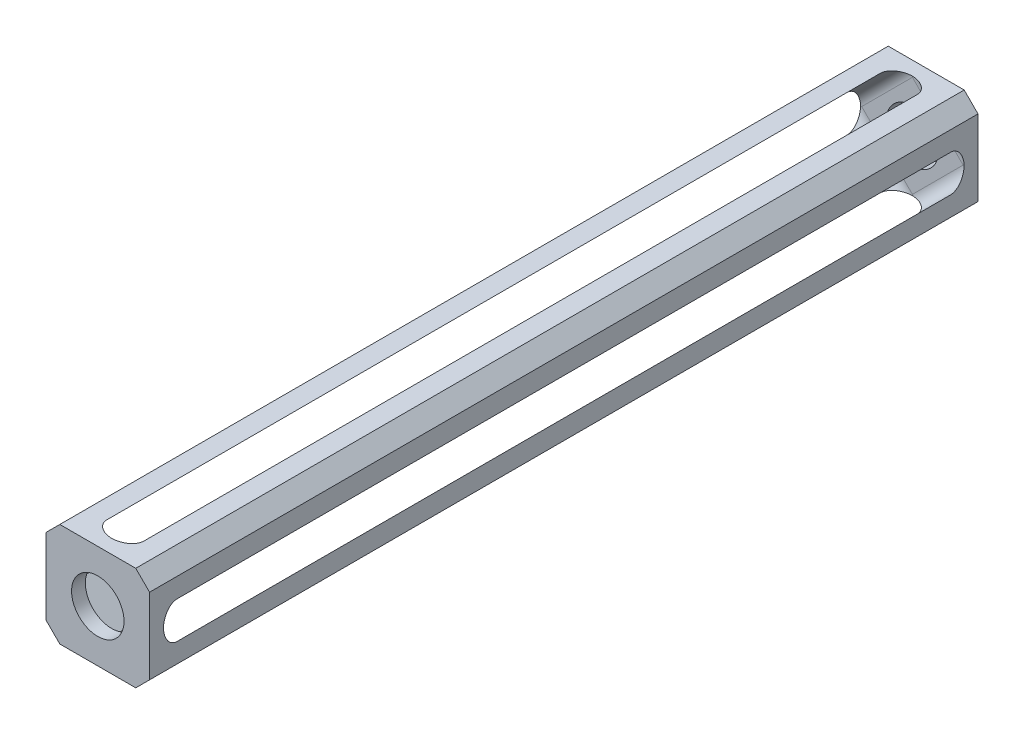
from build123d import *

# Parameters (mm, degrees)
SKETCH1_W           = 19.05
SKETCH1_H           = 19.05
BOSS_EXTRUDE1_DEPTH = 76.2
CHAMFER1_SIZE       = 2.54
SHELL1_T            = -2.54
FILLET1_R           = 2.54
SKETCH3_R           = 4.826
CUT_EXTRUDE1_DEPTH  = 153.9941543


with BuildPart() as part:
    # Sketch1 → Boss-Extrude1 (new, symmetric)
    with BuildSketch(Plane.XY):
        Rectangle(SKETCH1_W, SKETCH1_H)
    extrude(amount=BOSS_EXTRUDE1_DEPTH, both=True)

    # Chamfer1
    chamfer1_edges = [part.edges().sort_by_distance(p)[0] for p in [
        (9.525, -9.525, 0),
        (-9.525, -9.525, 0),
        (-9.525, 9.525, 0),
        (9.525, 9.525, 0),
    ]]
    chamfer(chamfer1_edges, length=CHAMFER1_SIZE)

    # Shell1
    shell1_openings = [part.faces().sort_by_distance(p)[0] for p in [
        (0, -9.525, 0),
        (-9.525, 0, 0),
        (0, 9.525, 0),
        (9.525, 0, 0),
    ]]
    offset(amount=SHELL1_T, openings=shell1_openings, kind=Kind.INTERSECTION)

    # Fillet1
    # the kernel refuses this fillet: 2.54 mm, written as the material it adds along each edge
    with BuildSketch(Plane(origin=(1.097230509, 14.015128061, -73.66), x_dir=(0.7071067811865476, -0.7071067811865476, 0), z_dir=(-0.7071067811865476, -0.7071067811865476, 0))) as fillet1_piece_1_section:
        with BuildLine():
            CenterArc((FILLET1_R, FILLET1_R), FILLET1_R, 180, 90)
            Line((0, FILLET1_R), (0, 0))
            Line((0, 0), (FILLET1_R, 0))
        make_face()
    fillet1_piece_1 = extrude(amount=21.372102448, mode=Mode.PRIVATE)
    fillet1_piece_1 = split(fillet1_piece_1, bisect_by=Plane(origin=(-9.525, 6.009158894, -73.121025702), z_dir=(1, 0, 0)), keep=Keep.TOP, mode=Mode.PRIVATE)
    fillet1_piece_1 = split(fillet1_piece_1, bisect_by=Plane(origin=(-6.009158894, 9.525, -73.121025702), z_dir=(0, -1, 0)), keep=Keep.TOP, mode=Mode.PRIVATE)
    add(fillet1_piece_1)
    with BuildSketch(Plane(origin=(14.015128061, 1.097230509, -73.66), x_dir=(-0.7071067811865476, 0.7071067811865476, 0), z_dir=(-0.7071067811865476, -0.7071067811865476, 0))) as fillet1_piece_2_section:
        with BuildLine():
            CenterArc((FILLET1_R, -FILLET1_R), FILLET1_R, 90, 90)
            Line((0, -FILLET1_R), (0, 0))
            Line((0, 0), (FILLET1_R, 0))
        make_face()
    fillet1_piece_2 = extrude(amount=21.372102448, mode=Mode.PRIVATE)
    fillet1_piece_2 = split(fillet1_piece_2, bisect_by=Plane(origin=(6.009158894, -9.525, -73.121025702), z_dir=(0, 1, 0)), keep=Keep.TOP, mode=Mode.PRIVATE)
    fillet1_piece_2 = split(fillet1_piece_2, bisect_by=Plane(origin=(9.525, -6.009158894, -73.121025702), z_dir=(-1, 0, 0)), keep=Keep.TOP, mode=Mode.PRIVATE)
    add(fillet1_piece_2)
    with BuildSketch(Plane(origin=(14.015128061, -1.097230509, -73.66), x_dir=(-0.7071067811865476, -0.7071067811865476, 0), z_dir=(-0.7071067811865476, 0.7071067811865476, 0))) as fillet1_piece_3_section:
        with BuildLine():
            CenterArc((FILLET1_R, FILLET1_R), FILLET1_R, 180, 90)
            Line((0, FILLET1_R), (0, 0))
            Line((0, 0), (FILLET1_R, 0))
        make_face()
    fillet1_piece_3 = extrude(amount=21.372102448, mode=Mode.PRIVATE)
    fillet1_piece_3 = split(fillet1_piece_3, bisect_by=Plane(origin=(9.525, 6.009158894, -73.121025702), z_dir=(-1, 0, 0)), keep=Keep.TOP, mode=Mode.PRIVATE)
    fillet1_piece_3 = split(fillet1_piece_3, bisect_by=Plane(origin=(6.009158894, 9.525, -73.121025702), z_dir=(0, -1, 0)), keep=Keep.TOP, mode=Mode.PRIVATE)
    add(fillet1_piece_3)
    with BuildSketch(Plane(origin=(1.097230509, -14.015128061, -73.66), x_dir=(0.7071067811865476, 0.7071067811865476, 0), z_dir=(-0.7071067811865476, 0.7071067811865476, 0))) as fillet1_piece_4_section:
        with BuildLine():
            CenterArc((FILLET1_R, -FILLET1_R), FILLET1_R, 90, 90)
            Line((0, -FILLET1_R), (0, 0))
            Line((0, 0), (FILLET1_R, 0))
        make_face()
    fillet1_piece_4 = extrude(amount=21.372102448, mode=Mode.PRIVATE)
    fillet1_piece_4 = split(fillet1_piece_4, bisect_by=Plane(origin=(-9.525, -6.009158894, -73.121025702), z_dir=(1, 0, 0)), keep=Keep.TOP, mode=Mode.PRIVATE)
    fillet1_piece_4 = split(fillet1_piece_4, bisect_by=Plane(origin=(-6.009158894, -9.525, -73.121025702), z_dir=(0, 1, 0)), keep=Keep.TOP, mode=Mode.PRIVATE)
    add(fillet1_piece_4)
    with BuildSketch(Plane(origin=(-14.015128061, -1.097230509, 73.66), x_dir=(0, 0, -1), z_dir=(0.7071067811865476, 0.7071067811865476, 0))) as fillet1_piece_5_section:
        with BuildLine():
            CenterArc((FILLET1_R, -FILLET1_R), FILLET1_R, 90, 90)
            Line((0, -FILLET1_R), (0, 0))
            Line((0, 0), (FILLET1_R, 0))
        make_face()
    fillet1_piece_5 = extrude(amount=21.372102448, mode=Mode.PRIVATE)
    fillet1_piece_5 = split(fillet1_piece_5, bisect_by=Plane(origin=(-9.525, 6.009158894, 73.121025702), z_dir=(1, 0, 0)), keep=Keep.TOP, mode=Mode.PRIVATE)
    fillet1_piece_5 = split(fillet1_piece_5, bisect_by=Plane(origin=(-6.009158894, 9.525, 73.121025702), z_dir=(0, -1, 0)), keep=Keep.TOP, mode=Mode.PRIVATE)
    add(fillet1_piece_5)
    with BuildSketch(Plane(origin=(-1.097230509, 14.015128061, 73.66), x_dir=(0, 0, -1), z_dir=(0.7071067811865476, -0.7071067811865476, 0))) as fillet1_piece_6_section:
        with BuildLine():
            CenterArc((FILLET1_R, -FILLET1_R), FILLET1_R, 90, 90)
            Line((0, -FILLET1_R), (0, 0))
            Line((0, 0), (FILLET1_R, 0))
        make_face()
    fillet1_piece_6 = extrude(amount=21.372102448, mode=Mode.PRIVATE)
    fillet1_piece_6 = split(fillet1_piece_6, bisect_by=Plane(origin=(9.525, 6.009158894, 73.121025702), z_dir=(-1, 0, 0)), keep=Keep.TOP, mode=Mode.PRIVATE)
    fillet1_piece_6 = split(fillet1_piece_6, bisect_by=Plane(origin=(6.009158894, 9.525, 73.121025702), z_dir=(0, -1, 0)), keep=Keep.TOP, mode=Mode.PRIVATE)
    add(fillet1_piece_6)
    with BuildSketch(Plane(origin=(14.015128061, 1.097230509, 73.66), x_dir=(-0.7071067811865476, 0.7071067811865476, 0), z_dir=(-0.7071067811865476, -0.7071067811865476, 0))) as fillet1_piece_7_section:
        with BuildLine():
            CenterArc((FILLET1_R, FILLET1_R), FILLET1_R, 180, 90)
            Line((0, FILLET1_R), (0, 0))
            Line((0, 0), (FILLET1_R, 0))
        make_face()
    fillet1_piece_7 = extrude(amount=21.372102448, mode=Mode.PRIVATE)
    fillet1_piece_7 = split(fillet1_piece_7, bisect_by=Plane(origin=(6.009158894, -9.525, 73.121025702), z_dir=(0, 1, 0)), keep=Keep.TOP, mode=Mode.PRIVATE)
    fillet1_piece_7 = split(fillet1_piece_7, bisect_by=Plane(origin=(9.525, -6.009158894, 73.121025702), z_dir=(-1, 0, 0)), keep=Keep.TOP, mode=Mode.PRIVATE)
    add(fillet1_piece_7)
    with BuildSketch(Plane(origin=(1.097230509, -14.015128061, 73.66), x_dir=(0.7071067811865476, 0.7071067811865476, 0), z_dir=(-0.7071067811865476, 0.7071067811865476, 0))) as fillet1_piece_8_section:
        with BuildLine():
            CenterArc((FILLET1_R, FILLET1_R), FILLET1_R, 180, 90)
            Line((0, FILLET1_R), (0, 0))
            Line((0, 0), (FILLET1_R, 0))
        make_face()
    fillet1_piece_8 = extrude(amount=21.372102448, mode=Mode.PRIVATE)
    fillet1_piece_8 = split(fillet1_piece_8, bisect_by=Plane(origin=(-9.525, -6.009158894, 73.121025702), z_dir=(1, 0, 0)), keep=Keep.TOP, mode=Mode.PRIVATE)
    fillet1_piece_8 = split(fillet1_piece_8, bisect_by=Plane(origin=(-6.009158894, -9.525, 73.121025702), z_dir=(0, 1, 0)), keep=Keep.TOP, mode=Mode.PRIVATE)
    add(fillet1_piece_8)

    # Sketch3 → Cut-Extrude1 (cut, through all)
    with BuildSketch(Plane.XY.offset(76.2)):
        Circle(SKETCH3_R)
    extrude(amount=-CUT_EXTRUDE1_DEPTH, mode=Mode.SUBTRACT)


solid = part.part
